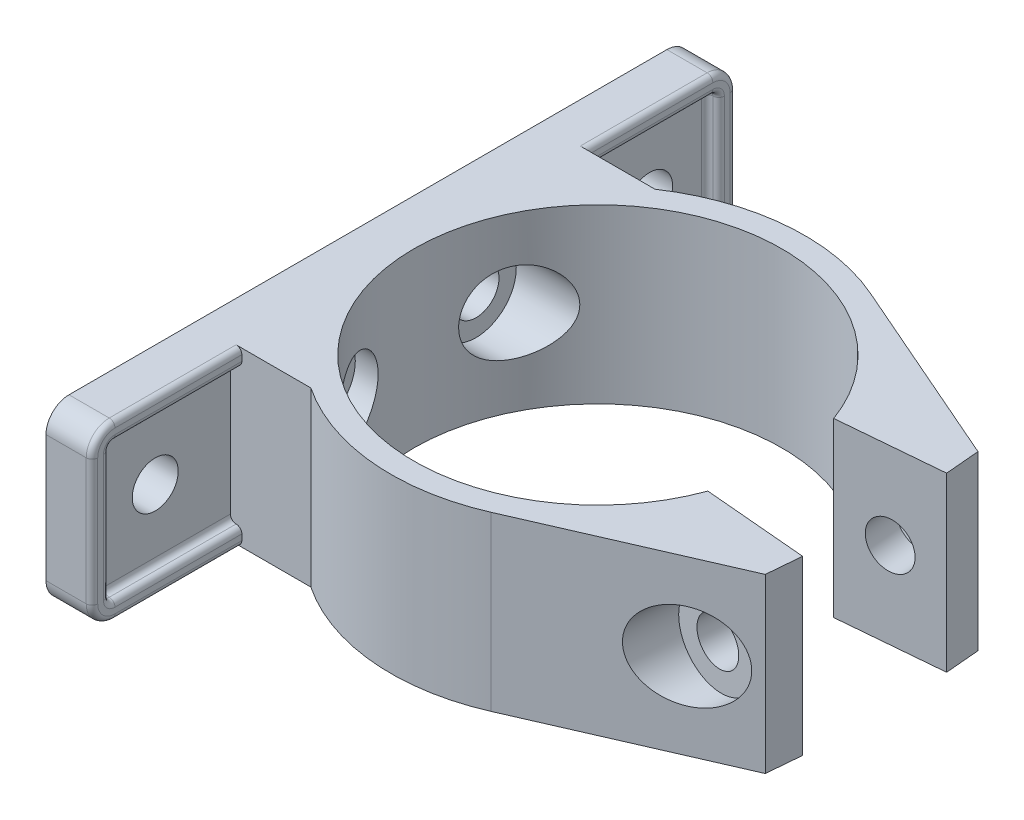
from build123d import *

# Parameters (mm, degrees)
BOSS_EXTRUDE1_DEPTH               = 7.5
BOSS_EXTRUDE1_DEPTH_BACK          = 7.5
SKETCH4_W                         = 2
SKETCH4_H                         = 4
F_4_0_4_DIAMETER_HOLE1_AT_2_COUNT = 2
F_4_0_4_DIAMETER_HOLE1_AT_2_PITCH = 43
F_4_0_4_DIAMETER_HOLE1_AT_3_COUNT = 2
F_4_0_4_DIAMETER_HOLE1_AT_3_PITCH = 14.5
F_4_0_4_DIAMETER_HOLE1_AT_4_COUNT = 2
F_4_0_4_DIAMETER_HOLE1_AT_4_PITCH = 28.5
FILLET1_R                         = 2
CUT_EXTRUDE1_DEPTH                = 1
CUT_EXTRUDE5_REACH                = 52.268
CUT_EXTRUDE5_END_RADIUS           = 16
SKETCH15_R                        = 3.5
CUT_EXTRUDE5_DIRECTION_2_DEPTH    = 0.6
FILLET2_R                         = 0.5
BOSS_EXTRUDE2_START               = -7.5
BOSS_EXTRUDE2_DEPTH               = 15
CUT_EXTRUDE6_REACH                = 45.576
SKETCH17_R                        = 2
CUT_EXTRUDE7_REACH                = 45.576


with BuildPart() as part:
    # Sketch1 → Boss-Extrude1 (new, two sides: drawn at the far end of the back side and taken through both)
    with BuildSketch(Plane(origin=(0, 0, 0), x_dir=(1, 0, 0), z_dir=(0, 1, 0)).offset(-BOSS_EXTRUDE1_DEPTH_BACK)):
        with BuildLine():
            Line((-16, 14.966629547), (-16, 28))
            Line((-16, 28), (-20, 28))
            Line((-20, 28), (-20, -28))
            Line((-20, -28), (-16, -28))
            Line((-16, -28), (-16, -14.966629547))
            Line((-16, -14.966629547), (-10, -14.966629547))
            ThreePointArc((-10, -14.966629547), (4.335878308, -17.469978801), (15.837588826, -8.553992061))
            Line((15.837588826, -8.553992061), (23.80714641, -9.251238003))
            Line((23.80714641, -9.251238003), (24.068613639, -6.262653909))
            Line((24.068613639, -6.262653909), (15.035081933, -5.472322293))
            ThreePointArc((15.035081933, -5.472322293), (-16, 0), (15.035081933, 5.472322293))
            Line((15.035081933, 5.472322293), (24.068613639, 6.262653909))
            Line((24.068613639, 6.262653909), (23.80714641, 9.251238003))
            Line((23.80714641, 9.251238003), (15.837588826, 8.553992061))
            ThreePointArc((15.837588826, 8.553992061), (4.335878308, 17.469978801), (-10, 14.966629547))
            Line((-10, 14.966629547), (-16, 14.966629547))
        make_face()
    extrude(amount=BOSS_EXTRUDE1_DEPTH + BOSS_EXTRUDE1_DEPTH_BACK)

    # Sketch4 → Ø4.0 (4) Diameter Hole1 (revolve, cut)
    with BuildSketch(Plane(origin=(-16, 0, 21.5), x_dir=(0, 0, -1), z_dir=(0, 1, 0))):
        with Locations((1, 2)):
            Rectangle(SKETCH4_W, SKETCH4_H)
    f_4_0_4_diameter_hole1 = revolve(axis=Axis((-9.65, 0, 21.5), (-1, 0, 0)), mode=Mode.SUBTRACT)

    # Ø4.0 (4) Diameter Hole1 at 2: Ø4.0 (4) Diameter Hole1 ×2
    with Locations(*[(0, 0, -i * F_4_0_4_DIAMETER_HOLE1_AT_2_PITCH) for i in range(1, F_4_0_4_DIAMETER_HOLE1_AT_2_COUNT)]):
        add(f_4_0_4_diameter_hole1, mode=Mode.SUBTRACT)

    # Ø4.0 (4) Diameter Hole1 at 3: Ø4.0 (4) Diameter Hole1 ×2
    with Locations(*[(0, 0, -i * F_4_0_4_DIAMETER_HOLE1_AT_3_PITCH) for i in range(1, F_4_0_4_DIAMETER_HOLE1_AT_3_COUNT)]):
        add(f_4_0_4_diameter_hole1, mode=Mode.SUBTRACT)

    # Ø4.0 (4) Diameter Hole1 at 4: Ø4.0 (4) Diameter Hole1 ×2
    with Locations(*[(0, 0, -i * F_4_0_4_DIAMETER_HOLE1_AT_4_PITCH) for i in range(1, F_4_0_4_DIAMETER_HOLE1_AT_4_COUNT)]):
        add(f_4_0_4_diameter_hole1, mode=Mode.SUBTRACT)

    # Fillet1
    fillet1_edges = [part.edges().sort_by_distance(p)[0] for p in [
        (-18, -7.5, -28),
        (-18, -7.5, 28),
        (-18, 7.5, -28),
        (-18, 7.5, 28),
    ]]
    fillet(fillet1_edges, radius=FILLET1_R)

    # Sketch10 → Cut-Extrude1 (cut)
    with BuildSketch(Plane(origin=(-16, 0, 0), x_dir=(0, 0, -1), z_dir=(1, 0, 0))):
        with BuildLine():
            Line((14.966629547, 6), (14.966629547, -6))
            Line((14.966629547, -6), (26, -6))
            ThreePointArc((26, -6), (26.353553391, -5.853553391), (26.5, -5.5))
            Line((26.5, -5.5), (26.5, 5.5))
            ThreePointArc((26.5, 5.5), (26.353553391, 5.853553391), (26, 6))
            Line((26, 6), (14.966629547, 6))
        make_face()
        with BuildLine():
            Line((-14.966629547, 6), (-14.966629547, -6))
            Line((-14.966629547, -6), (-26, -6))
            ThreePointArc((-26, -6), (-26.353553391, -5.853553391), (-26.5, -5.5))
            Line((-26.5, -5.5), (-26.5, 5.5))
            ThreePointArc((-26.5, 5.5), (-26.353553391, 5.853553391), (-26, 6))
            Line((-26, 6), (-14.966629547, 6))
        make_face()
    extrude(amount=-CUT_EXTRUDE1_DEPTH, mode=Mode.SUBTRACT)

    # Cut-Extrude5: up to this cylinder (the profile starts outside it)
    cut_extrude5_end = Plane(origin=(0, 0, 0), z_dir=(0, 1, 0)) * Cylinder(CUT_EXTRUDE5_END_RADIUS, 137.536, mode=Mode.PRIVATE)
    # Sketch15 → Cut-Extrude5 (cut, up to the surface)
    with BuildSketch(Plane(origin=(-17, 0, 0), x_dir=(0, 0, -1), z_dir=(1, 0, 0)), mode=Mode.PRIVATE) as cut_extrude5_sk1:
        with Locations((7, 0)):
            Circle(SKETCH15_R)
    cut_extrude5_tool1 = extrude(cut_extrude5_sk1.sketch, amount=CUT_EXTRUDE5_REACH, mode=Mode.PRIVATE) - cut_extrude5_end
    add(cut_extrude5_tool1.solids().sort_by_distance((-17, 0, -7))[0], mode=Mode.SUBTRACT)
    # Sketch15 → Cut-Extrude5 (cut, up to the surface)
    with BuildSketch(Plane(origin=(-17, 0, 0), x_dir=(0, 0, -1), z_dir=(1, 0, 0)), mode=Mode.PRIVATE) as cut_extrude5_sk2:
        with Locations((-7, 0)):
            Circle(SKETCH15_R)
    cut_extrude5_tool2 = extrude(cut_extrude5_sk2.sketch, amount=CUT_EXTRUDE5_REACH, mode=Mode.PRIVATE) - cut_extrude5_end
    add(cut_extrude5_tool2.solids().sort_by_distance((-17, 0, 7))[0], mode=Mode.SUBTRACT)

    # Sketch15 → Cut-Extrude5 direction 2 (cut)
    with BuildSketch(Plane(origin=(-17, 0, 0), x_dir=(0, 0, -1), z_dir=(1, 0, 0))):
        with Locations((7, 0)):
            Circle(SKETCH15_R)
        with Locations((-7, 0)):
            Circle(SKETCH15_R)
    extrude(amount=-CUT_EXTRUDE5_DIRECTION_2_DEPTH, mode=Mode.SUBTRACT)

    # Fillet2
    fillet2_edges = [part.edges().sort_by_distance(p)[0] for p in [
        (-17, -6, -20.483314774),
        (-17, -5.853553391, -26.353553391),
        (-17, 0, -26.5),
        (-17, 5.853553391, -26.353553391),
        (-16, -6, -20.483314774),
        (-16, -5.853553391, -26.353553391),
        (-16, 6, -20.483314774),
        (-16, 5.853553391, -26.353553391),
        (-16, -7.5, -20.483314774),
        (-16, -6.914213562, -27.414213562),
        (-16, 7.5, -20.483314774),
        (-16, 6.914213562, -27.414213562),
        (-16, -7.5, 20.483314774),
        (-16, -6.914213562, 27.414213562),
        (-16, 0, 28),
        (-16, 6.914213562, 27.414213562),
        (-17, -6, 20.483314774),
        (-17, -5.853553391, 26.353553391),
        (-17, 0, 26.5),
        (-17, 5.853553391, 26.353553391),
        (-16, -6, 20.483314774),
        (-16, -5.853553391, 26.353553391),
        (-16, 0, 26.5),
        (-16, 5.853553391, 26.353553391),
        (-17, 6, -20.483314774),
        (-16, 0, -26.5),
        (-16, 0, -28),
        (-16, 7.5, 20.483314774),
        (-17, 6, 20.483314774),
        (-16, 6, 20.483314774),
    ]]
    fillet(fillet2_edges, radius=FILLET2_R - 0.0001)  # a hair under: the kernel refuses the full size

    # Sketch11 → Boss-Extrude2 (add)
    with BuildSketch(Plane(origin=(0, 0, 0), x_dir=(1, 0, 0), z_dir=(0, 1, 0)).offset(BOSS_EXTRUDE2_START)):
        with BuildLine():
            Line((23.80714641, -9.251238003), (7.198399175, -16.497971066))
            ThreePointArc((7.198399175, -16.497971066), (12.183631905, -13.24987221), (15.837588826, -8.553992061))
            Line((15.837588826, -8.553992061), (23.80714641, -9.251238003))
        make_face()
        with BuildLine():
            Line((23.80714641, 9.251238003), (7.198399175, 16.497971066))
            ThreePointArc((7.198399175, 16.497971066), (12.183631905, 13.24987221), (15.837588826, 8.553992061))
            Line((15.837588826, 8.553992061), (23.80714641, 9.251238003))
        make_face()
    extrude(amount=BOSS_EXTRUDE2_DEPTH)

    # Sketch16 → Cut-Revolve1 (revolve, cut)
    with BuildSketch(Plane(origin=(0, 0, 0), x_dir=(1, 0, 0), z_dir=(0, 1, 0)), mode=Mode.PRIVATE) as cut_revolve1_sk:
        Polygon((19.551847786, -5.867488101), (21.544237182, -6.041799587), (21.282769954, -9.030383681), (23.026110675, -9.182906231), (22.079695592, -20.000480134), (18.343965474, -19.673646099), align=None)
    revolve(cut_revolve1_sk.sketch.rotate(Axis((19.551847786, 0, 5.867488101), (-0.08715574274765382, 0, 0.996194698091746)), 180), axis=Axis((19.551847786, 0, 5.867488101), (-0.08715574274765382, 0, 0.996194698091746)), mode=Mode.SUBTRACT)

    # Sketch17 → Cut-Extrude6 (cut, up to next)
    with BuildSketch(Plane(origin=(-0.622388286, 0, -7.113930662), x_dir=(0.996194698091746, 0, -0.08715574274765478), z_dir=(0.08715574274765478, 0, 0.996194698091746)), mode=Mode.PRIVATE) as cut_extrude6_sk1:
        with Locations((19.988832385, 0)):
            Circle(SKETCH17_R)
    cut_extrude6_tool1 = extrude(cut_extrude6_sk1.sketch, amount=CUT_EXTRUDE6_REACH, mode=Mode.PRIVATE) & part.part
    add(cut_extrude6_tool1.solids().sort_by_distance((19.290381, 0, -8.856072))[0], mode=Mode.SUBTRACT)

    # Cut-Extrude7: up to this plane
    cut_extrude7_end = Plane(origin=(23.80714641, -25.910792681, -9.251238003), z_dir=(0.39991106530273124, 0, -0.9165539481385887))
    # Sketch18 → Cut-Extrude7 (cut, up to the surface)
    with BuildSketch(Plane(origin=(-0.622388286, 0, -7.113930662), x_dir=(0.996194698091746, 0, -0.08715574274765478), z_dir=(0.08715574274765478, 0, 0.996194698091746)), mode=Mode.PRIVATE) as cut_extrude7_sk1:
        Polygon((16.988832385, -1.732050808), (19.988832385, -3.464101615), (22.988832385, -1.732050808), (22.988832385, 1.732050808), (19.988832385, 3.464101615), (16.988832385, 1.732050808), align=None)
    cut_extrude7_tool1 = split(extrude(cut_extrude7_sk1.sketch, amount=-CUT_EXTRUDE7_REACH, mode=Mode.PRIVATE), bisect_by=cut_extrude7_end, keep=Keep.BOTH, mode=Mode.PRIVATE)
    add(cut_extrude7_tool1.solids().sort_by_distance((19.290381, 0, -8.856072))[0], mode=Mode.SUBTRACT)


solid = part.part
